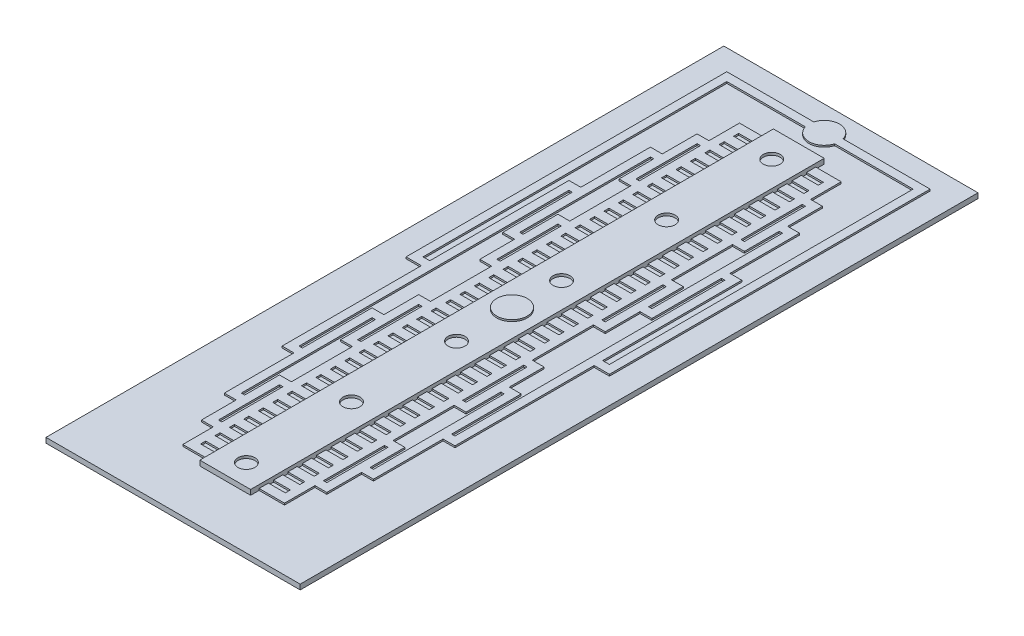
from build123d import *

# Parameters (mm, degrees)
SKETCH2_W           = 15
SKETCH2_H           = 40
BOSS_EXTRUDE1_DEPTH = 0.3
SKETCH3_W           = 3
SKETCH3_H           = 33.85
BOSS_EXTRUDE2_DEPTH = 0.3
SKETCH4_W           = 1.5
SKETCH4_H           = 32.85
BOSS_EXTRUDE3_DEPTH = 0.1
SKETCH5_W           = 1
SKETCH5_H           = 0.3
CUT_EXTRUDE1_DEPTH  = 0.1
BOSS_EXTRUDE4_DEPTH = 0.1
SKETCH7_R           = 0.9
BOSS_EXTRUDE5_DEPTH = 0.1
SKETCH8_R           = 0.5
CUT_EXTRUDE2_DEPTH  = 0.15


with BuildPart() as part:
    # Sketch2 → Boss-Extrude1 (new body)
    with BuildSketch(Plane(origin=(0, 0, 0), x_dir=(1, 0, 0), z_dir=(0, 1, 0))):
        Rectangle(SKETCH2_W, SKETCH2_H)
    extrude(amount=BOSS_EXTRUDE1_DEPTH)

    # Sketch3 → Boss-Extrude2 (add)
    with BuildSketch(Plane(origin=(0, 0.3, 0), x_dir=(1, 0, 0), z_dir=(0, 1, 0))):
        Rectangle(SKETCH3_W, SKETCH3_H)
    extrude(amount=BOSS_EXTRUDE2_DEPTH)

    # Sketch4 → Boss-Extrude3 (add)
    with BuildSketch(Plane(origin=(0, 0.3, 0), x_dir=(1, 0, 0), z_dir=(0, 1, 0))):
        with Locations((2.25, 0)):
            Rectangle(SKETCH4_W, SKETCH4_H)
        with Locations((-2.25, 0)):
            Rectangle(SKETCH4_W, SKETCH4_H)
    extrude(amount=BOSS_EXTRUDE3_DEPTH)

    # Sketch5 → Cut-Extrude1 (cut)
    with BuildSketch(Plane(origin=(0, 0.4, 0), x_dir=(1, 0, 0), z_dir=(0, 1, 0))):
        with Locations((2, 15.725)):
            Rectangle(SKETCH5_W, SKETCH5_H)
        with Locations((-2, 15.725)):
            Rectangle(SKETCH5_W, SKETCH5_H)
        with Locations((-2, 14.875)):
            Rectangle(SKETCH5_W, SKETCH5_H)
        with Locations((-2, 14.025)):
            Rectangle(SKETCH5_W, SKETCH5_H)
        with Locations((-2, 13.175)):
            Rectangle(SKETCH5_W, SKETCH5_H)
        with Locations((-2, 12.325)):
            Rectangle(SKETCH5_W, SKETCH5_H)
        with Locations((-2, 11.475)):
            Rectangle(SKETCH5_W, SKETCH5_H)
        with Locations((-2, 10.625)):
            Rectangle(SKETCH5_W, SKETCH5_H)
        with Locations((-2, 9.775)):
            Rectangle(SKETCH5_W, SKETCH5_H)
        with Locations((-2, 8.925)):
            Rectangle(SKETCH5_W, SKETCH5_H)
        with Locations((-2, 8.075)):
            Rectangle(SKETCH5_W, SKETCH5_H)
        with Locations((-2, 7.225)):
            Rectangle(SKETCH5_W, SKETCH5_H)
        with Locations((-2, 6.375)):
            Rectangle(SKETCH5_W, SKETCH5_H)
        with Locations((-2, 5.525)):
            Rectangle(SKETCH5_W, SKETCH5_H)
        with Locations((-2, 4.675)):
            Rectangle(SKETCH5_W, SKETCH5_H)
        with Locations((-2, 3.825)):
            Rectangle(SKETCH5_W, SKETCH5_H)
        with Locations((-2, 2.975)):
            Rectangle(SKETCH5_W, SKETCH5_H)
        with Locations((-2, 2.125)):
            Rectangle(SKETCH5_W, SKETCH5_H)
        with Locations((-2, 1.275)):
            Rectangle(SKETCH5_W, SKETCH5_H)
        with Locations((-2, 0.425)):
            Rectangle(SKETCH5_W, SKETCH5_H)
        with Locations((-2, -0.425)):
            Rectangle(SKETCH5_W, SKETCH5_H)
        with Locations((-2, -1.275)):
            Rectangle(SKETCH5_W, SKETCH5_H)
        with Locations((-2, -2.125)):
            Rectangle(SKETCH5_W, SKETCH5_H)
        with Locations((-2, -2.975)):
            Rectangle(SKETCH5_W, SKETCH5_H)
        with Locations((-2, -3.825)):
            Rectangle(SKETCH5_W, SKETCH5_H)
        with Locations((-2, -4.675)):
            Rectangle(SKETCH5_W, SKETCH5_H)
        with Locations((-2, -5.525)):
            Rectangle(SKETCH5_W, SKETCH5_H)
        with Locations((-2, -6.375)):
            Rectangle(SKETCH5_W, SKETCH5_H)
        with Locations((-2, -7.225)):
            Rectangle(SKETCH5_W, SKETCH5_H)
        with Locations((-2, -8.075)):
            Rectangle(SKETCH5_W, SKETCH5_H)
        with Locations((-2, -8.925)):
            Rectangle(SKETCH5_W, SKETCH5_H)
        with Locations((-2, -9.775)):
            Rectangle(SKETCH5_W, SKETCH5_H)
        with Locations((-2, -10.625)):
            Rectangle(SKETCH5_W, SKETCH5_H)
        with Locations((-2, -11.475)):
            Rectangle(SKETCH5_W, SKETCH5_H)
        with Locations((-2, -12.325)):
            Rectangle(SKETCH5_W, SKETCH5_H)
        with Locations((-2, -13.175)):
            Rectangle(SKETCH5_W, SKETCH5_H)
        with Locations((-2, -14.025)):
            Rectangle(SKETCH5_W, SKETCH5_H)
        with Locations((-2, -14.875)):
            Rectangle(SKETCH5_W, SKETCH5_H)
        with Locations((-2, -15.725)):
            Rectangle(SKETCH5_W, SKETCH5_H)
        with Locations((2, 14.875)):
            Rectangle(SKETCH5_W, SKETCH5_H)
        with Locations((2, 14.025)):
            Rectangle(SKETCH5_W, SKETCH5_H)
        with Locations((2, 13.175)):
            Rectangle(SKETCH5_W, SKETCH5_H)
        with Locations((2, 12.325)):
            Rectangle(SKETCH5_W, SKETCH5_H)
        with Locations((2, 11.475)):
            Rectangle(SKETCH5_W, SKETCH5_H)
        with Locations((2, 10.625)):
            Rectangle(SKETCH5_W, SKETCH5_H)
        with Locations((2, 9.775)):
            Rectangle(SKETCH5_W, SKETCH5_H)
        with Locations((2, 8.925)):
            Rectangle(SKETCH5_W, SKETCH5_H)
        with Locations((2, 8.075)):
            Rectangle(SKETCH5_W, SKETCH5_H)
        with Locations((2, 7.225)):
            Rectangle(SKETCH5_W, SKETCH5_H)
        with Locations((2, 6.375)):
            Rectangle(SKETCH5_W, SKETCH5_H)
        with Locations((2, 5.525)):
            Rectangle(SKETCH5_W, SKETCH5_H)
        with Locations((2, 4.675)):
            Rectangle(SKETCH5_W, SKETCH5_H)
        with Locations((2, 3.825)):
            Rectangle(SKETCH5_W, SKETCH5_H)
        with Locations((2, 2.975)):
            Rectangle(SKETCH5_W, SKETCH5_H)
        with Locations((2, 2.125)):
            Rectangle(SKETCH5_W, SKETCH5_H)
        with Locations((2, 1.275)):
            Rectangle(SKETCH5_W, SKETCH5_H)
        with Locations((2, 0.425)):
            Rectangle(SKETCH5_W, SKETCH5_H)
        with Locations((2, -0.425)):
            Rectangle(SKETCH5_W, SKETCH5_H)
        with Locations((2, -1.275)):
            Rectangle(SKETCH5_W, SKETCH5_H)
        with Locations((2, -2.125)):
            Rectangle(SKETCH5_W, SKETCH5_H)
        with Locations((2, -2.975)):
            Rectangle(SKETCH5_W, SKETCH5_H)
        with Locations((2, -3.825)):
            Rectangle(SKETCH5_W, SKETCH5_H)
        with Locations((2, -4.675)):
            Rectangle(SKETCH5_W, SKETCH5_H)
        with Locations((2, -5.525)):
            Rectangle(SKETCH5_W, SKETCH5_H)
        with Locations((2, -6.375)):
            Rectangle(SKETCH5_W, SKETCH5_H)
        with Locations((2, -7.225)):
            Rectangle(SKETCH5_W, SKETCH5_H)
        with Locations((2, -8.075)):
            Rectangle(SKETCH5_W, SKETCH5_H)
        with Locations((2, -8.925)):
            Rectangle(SKETCH5_W, SKETCH5_H)
        with Locations((2, -9.775)):
            Rectangle(SKETCH5_W, SKETCH5_H)
        with Locations((2, -10.625)):
            Rectangle(SKETCH5_W, SKETCH5_H)
        with Locations((2, -11.475)):
            Rectangle(SKETCH5_W, SKETCH5_H)
        with Locations((2, -12.325)):
            Rectangle(SKETCH5_W, SKETCH5_H)
        with Locations((2, -13.175)):
            Rectangle(SKETCH5_W, SKETCH5_H)
        with Locations((2, -14.025)):
            Rectangle(SKETCH5_W, SKETCH5_H)
        with Locations((2, -14.875)):
            Rectangle(SKETCH5_W, SKETCH5_H)
        with Locations((2, -15.725)):
            Rectangle(SKETCH5_W, SKETCH5_H)
    extrude(amount=-CUT_EXTRUDE1_DEPTH, mode=Mode.SUBTRACT)

    # Sketch6 → Boss-Extrude4 (add)
    with BuildSketch(Plane(origin=(0, 0.3, 0), x_dir=(1, 0, 0), z_dir=(0, 1, 0))):
        with BuildLine():
            Line((-0.864580823, 18.675), (-6, 18.675))
            Line((-6, 18.675), (-6, -0.25))
            Line((-6, -0.25), (-5.1, -0.25))
            Line((-5.1, -0.25), (-5.1, -8.467428181))
            Line((-5.1, -8.467428181), (-4.4, -8.467428181))
            Line((-4.4, -8.467428181), (-4.4, -12.574499544))
            Line((-4.4, -12.574499544), (-3.7, -12.574499544))
            Line((-3.7, -12.574499544), (-3.7, -14.628035226))
            Line((-3.7, -14.628035226), (-3, -14.628035226))
            Line((-3, -14.628035226), (-3, -14.128035226))
            Line((-3, -14.128035226), (-3.2, -14.128035226))
            Line((-3.2, -14.128035226), (-3.2, -10.520963862))
            Line((-3.2, -10.520963862), (-3, -10.520963862))
            Line((-3, -10.520963862), (-3, -10.020963862))
            Line((-3, -10.020963862), (-3.7, -10.020963862))
            Line((-3.7, -10.020963862), (-3.7, -12.074499544))
            Line((-3.7, -12.074499544), (-3.9, -12.074499544))
            Line((-3.9, -12.074499544), (-3.9, -4.360356817))
            Line((-3.9, -4.360356817), (-3.7, -4.360356817))
            Line((-3.7, -4.360356817), (-3.7, -6.413892499))
            Line((-3.7, -6.413892499), (-3, -6.413892499))
            Line((-3, -6.413892499), (-3, -5.913892499))
            Line((-3, -5.913892499), (-3.2, -5.913892499))
            Line((-3.2, -5.913892499), (-3.2, -2.306821136))
            Line((-3.2, -2.306821136), (-3, -2.306821136))
            Line((-3, -2.306821136), (-3, -1.806821136))
            Line((-3, -1.806821136), (-3.7, -1.806821136))
            Line((-3.7, -1.806821136), (-3.7, -3.860356817))
            Line((-3.7, -3.860356817), (-4.4, -3.860356817))
            Line((-4.4, -3.860356817), (-4.4, -7.967428181))
            Line((-4.4, -7.967428181), (-4.6, -7.967428181))
            Line((-4.6, -7.967428181), (-4.6, 7.960857273))
            Line((-4.6, 7.960857273), (-4.4, 7.960857273))
            Line((-4.4, 7.960857273), (-4.4, 3.85378591))
            Line((-4.4, 3.85378591), (-3.7, 3.85378591))
            Line((-3.7, 3.85378591), (-3.7, 1.800250228))
            Line((-3.7, 1.800250228), (-3, 1.800250228))
            Line((-3, 1.800250228), (-3, 2.300250228))
            Line((-3, 2.300250228), (-3.2, 2.300250228))
            Line((-3.2, 2.300250228), (-3.2, 5.907321591))
            Line((-3.2, 5.907321591), (-3, 5.907321591))
            Line((-3, 5.907321591), (-3, 6.407321591))
            Line((-3, 6.407321591), (-3.7, 6.407321591))
            Line((-3.7, 6.407321591), (-3.7, 4.35378591))
            Line((-3.7, 4.35378591), (-3.9, 4.35378591))
            Line((-3.9, 4.35378591), (-3.9, 12.067928637))
            Line((-3.9, 12.067928637), (-3.7, 12.067928637))
            Line((-3.7, 12.067928637), (-3.7, 10.014392955))
            Line((-3.7, 10.014392955), (-3, 10.014392955))
            Line((-3, 10.014392955), (-3, 10.514392955))
            Line((-3, 10.514392955), (-3.2, 10.514392955))
            Line((-3.2, 10.514392955), (-3.2, 14.121464318))
            Line((-3.2, 14.121464318), (-3, 14.121464318))
            Line((-3, 14.121464318), (-3, 14.621464318))
            Line((-3, 14.621464318), (-3.7, 14.621464318))
            Line((-3.7, 14.621464318), (-3.7, 12.567928637))
            Line((-3.7, 12.567928637), (-4.4, 12.567928637))
            Line((-4.4, 12.567928637), (-4.4, 8.460857273))
            Line((-4.4, 8.460857273), (-5.1, 8.460857273))
            Line((-5.1, 8.460857273), (-5.1, 0.25))
            Line((-5.1, 0.25), (-5.5, 0.25))
            Line((-5.5, 0.25), (-5.5, 18.175))
            Line((-5.5, 18.175), (-0.864580823, 18.175))
            ThreePointArc((-0.864580823, 18.175), (0, 17.525), (0.864580823, 18.175))
            Line((0.864580823, 18.175), (5.5, 18.175))
            Line((5.5, 18.175), (5.5, 0.25))
            Line((5.5, 0.25), (5.1, 0.25))
            Line((5.1, 0.25), (5.1, 8.460857273))
            Line((5.1, 8.460857273), (4.4, 8.460857273))
            Line((4.4, 8.460857273), (4.4, 12.567928637))
            Line((4.4, 12.567928637), (3.7, 12.567928637))
            Line((3.7, 12.567928637), (3.7, 14.621464318))
            Line((3.7, 14.621464318), (3, 14.621464318))
            Line((3, 14.621464318), (3, 14.121464318))
            Line((3, 14.121464318), (3.2, 14.121464318))
            Line((3.2, 14.121464318), (3.2, 10.514392955))
            Line((3.2, 10.514392955), (3, 10.514392955))
            Line((3, 10.514392955), (3, 10.014392955))
            Line((3, 10.014392955), (3.7, 10.014392955))
            Line((3.7, 10.014392955), (3.7, 12.067928637))
            Line((3.7, 12.067928637), (3.9, 12.067928637))
            Line((3.9, 12.067928637), (3.9, 4.35378591))
            Line((3.9, 4.35378591), (3.7, 4.35378591))
            Line((3.7, 4.35378591), (3.7, 6.407321591))
            Line((3.7, 6.407321591), (3, 6.407321591))
            Line((3, 6.407321591), (3, 5.907321591))
            Line((3, 5.907321591), (3.2, 5.907321591))
            Line((3.2, 5.907321591), (3.2, 2.300250228))
            Line((3.2, 2.300250228), (3, 2.300250228))
            Line((3, 2.300250228), (3, 1.800250228))
            Line((3, 1.800250228), (3.7, 1.800250228))
            Line((3.7, 1.800250228), (3.7, 3.85378591))
            Line((3.7, 3.85378591), (4.4, 3.85378591))
            Line((4.4, 3.85378591), (4.4, 7.960857273))
            Line((4.4, 7.960857273), (4.6, 7.960857273))
            Line((4.6, 7.960857273), (4.6, -7.967428181))
            Line((4.6, -7.967428181), (4.4, -7.967428181))
            Line((4.4, -7.967428181), (4.4, -3.860356817))
            Line((4.4, -3.860356817), (3.7, -3.860356817))
            Line((3.7, -3.860356817), (3.7, -1.806821136))
            Line((3.7, -1.806821136), (3, -1.806821136))
            Line((3, -1.806821136), (3, -2.306821136))
            Line((3, -2.306821136), (3.2, -2.306821136))
            Line((3.2, -2.306821136), (3.2, -5.913892499))
            Line((3.2, -5.913892499), (3, -5.913892499))
            Line((3, -5.913892499), (3, -6.413892499))
            Line((3, -6.413892499), (3.7, -6.413892499))
            Line((3.7, -6.413892499), (3.7, -4.360356817))
            Line((3.7, -4.360356817), (3.9, -4.360356817))
            Line((3.9, -4.360356817), (3.9, -12.074499544))
            Line((3.9, -12.074499544), (3.7, -12.074499544))
            Line((3.7, -12.074499544), (3.7, -10.020963862))
            Line((3.7, -10.020963862), (3, -10.020963862))
            Line((3, -10.020963862), (3, -10.520963862))
            Line((3, -10.520963862), (3.2, -10.520963862))
            Line((3.2, -10.520963862), (3.2, -14.128035226))
            Line((3.2, -14.128035226), (3, -14.128035226))
            Line((3, -14.128035226), (3, -14.628035226))
            Line((3, -14.628035226), (3.7, -14.628035226))
            Line((3.7, -14.628035226), (3.7, -12.574499544))
            Line((3.7, -12.574499544), (4.4, -12.574499544))
            Line((4.4, -12.574499544), (4.4, -8.467428181))
            Line((4.4, -8.467428181), (5.1, -8.467428181))
            Line((5.1, -8.467428181), (5.1, -0.25))
            Line((5.1, -0.25), (6, -0.25))
            Line((6, -0.25), (6, 18.675))
            Line((6, 18.675), (0.864580823, 18.675))
            ThreePointArc((0.864580823, 18.675), (0, 19.325), (-0.864580823, 18.675))
        make_face()
    extrude(amount=BOSS_EXTRUDE4_DEPTH)

    # Sketch7 → Boss-Extrude5 (add)
    with BuildSketch(Plane(origin=(0, 0.6, 0), x_dir=(1, 0, 0), z_dir=(0, 1, 0))):
        Circle(SKETCH7_R)
    extrude(amount=BOSS_EXTRUDE5_DEPTH)

    # Sketch8 → Cut-Extrude2 (cut)
    with BuildSketch(Plane(origin=(0, 0.6, 0), x_dir=(1, 0, 0), z_dir=(0, 1, 0))):
        with Locations((0, 15.326485242)):
            Circle(SKETCH8_R)
        with Locations((0, 9.126485242)):
            Circle(SKETCH8_R)
        with Locations((0, 2.926485242)):
            Circle(SKETCH8_R)
        with Locations((0, -3.273514758)):
            Circle(SKETCH8_R)
        with Locations((0, -9.473514758)):
            Circle(SKETCH8_R)
        with Locations((0, -15.673514758)):
            Circle(SKETCH8_R)
    extrude(amount=-CUT_EXTRUDE2_DEPTH, mode=Mode.SUBTRACT)


solid = part.part
